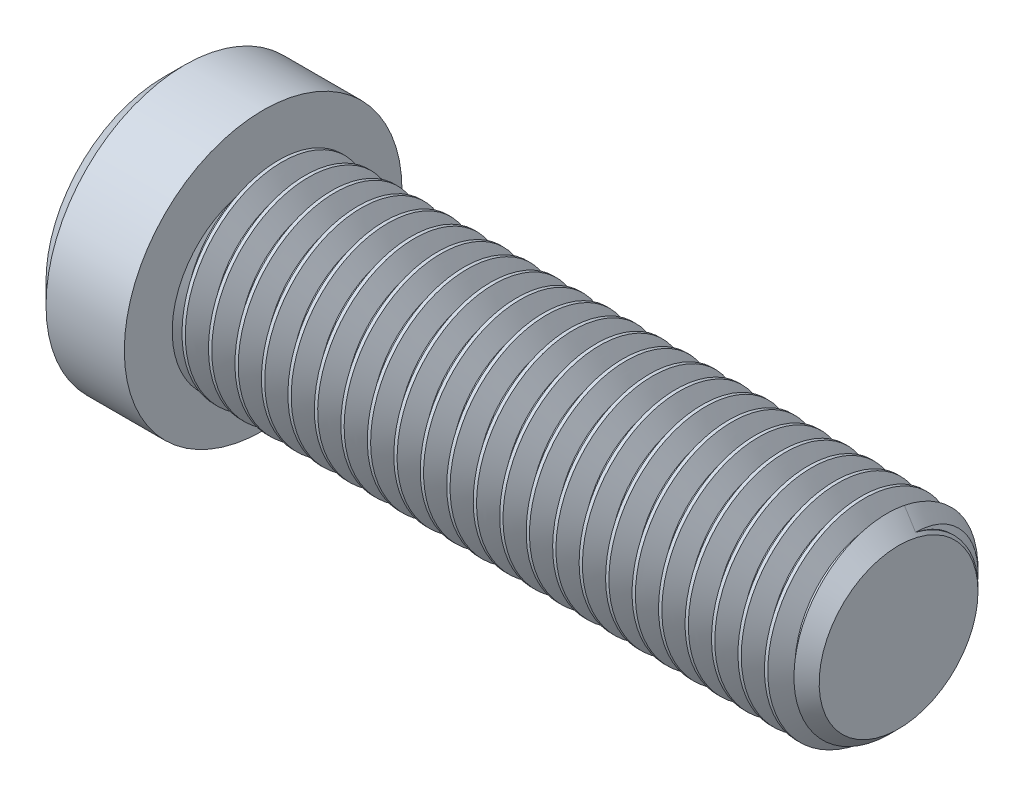
from build123d import *

# Parameters (mm, degrees)
SKETCH2_R           = 3.96875
BOSS_EXTRUDE1_DEPTH = 25.4
CHAMFER1_SIZE       = 0.79375
CUT_SWEEP1_PITCH    = 1.058333333
CUT_EXTRUDE1_DEPTH  = 2.794


with BuildPart() as part:
    # Sketch2 → Boss-Extrude1 (new body)
    with BuildSketch(Plane(origin=(12.7, 0, 0), x_dir=(0, 0, -1), z_dir=(1, 0, 0))):
        Circle(SKETCH2_R)
    extrude(amount=-BOSS_EXTRUDE1_DEPTH)

    # Chamfer1
    chamfer1_edges = [part.edges().sort_by_distance(p)[0] for p in [
        (12.7, 0, 3.96875),
    ]]
    chamfer(chamfer1_edges, length=CHAMFER1_SIZE)

    # Cut-Sweep1: the profile of Sketch5 profile screwed along a right-hand helix of 25 turns, 8 arcs to a turn; built about Z, then put on its axis
    cut_sweep1_z = Axis((0, 0, 0), (0, 0, 1))
    cut_sweep1_corners = [(3.96905, 0, 0.463194038), (3.96905, 0, -0.463194038), (3.281342336, 0, -0.066145833), (3.281342336, 0, 0.066145833)]
    with BuildLine(mode=Mode.PRIVATE) as cut_sweep1_profile:
        Line(cut_sweep1_corners[0], cut_sweep1_corners[1])
        Line(cut_sweep1_corners[1], cut_sweep1_corners[2])
        Line(cut_sweep1_corners[2], cut_sweep1_corners[3])
        Line(cut_sweep1_corners[3], cut_sweep1_corners[0])
    cut_sweep1_cap = Face(cut_sweep1_profile.wire())
    cut_sweep1_turn_angles = [0, 22.5, 45, 67.5, 90, 112.5, 135, 157.5, 180, 202.5, 225, 247.5, 270, 292.5, 315, 337.5, 360]
    cut_sweep1_turn_weights = [1, 0.9238795325112867, 1, 0.9238795325112867, 1, 0.9238795325112867, 1, 0.9238795325112867, 1, 0.9238795325112867, 1, 0.9238795325112867, 1, 0.9238795325112867, 1, 0.9238795325112867, 1]
    cut_sweep1_turn_rails = [Edge.make_bspline([Vector(p[0], p[1], 0).rotate(cut_sweep1_z, cut_sweep1_turn_angles[k]) / cut_sweep1_turn_weights[k] + Vector(0, 0, p[2] + CUT_SWEEP1_PITCH * cut_sweep1_turn_angles[k] / 360) for k in range(17)], [0, 0, 0, 1, 1, 2, 2, 3, 3, 4, 4, 5, 5, 6, 6, 7, 7, 8, 8, 8], 2, cut_sweep1_turn_weights) for p in cut_sweep1_corners]
    cut_sweep1_turn_sides = [Face.make_surface_from_curves(cut_sweep1_turn_rails[p[0]], cut_sweep1_turn_rails[p[1]]) for p in [(0, 1), (1, 2), (2, 3), (3, 0)]]
    cut_sweep1 = Plane(origin=(12.7, 0, 0), x_dir=(0, 1, 0), z_dir=(-1, 0, 0)) * Solid(Shell([*[p.moved(Location((0, 0, CUT_SWEEP1_PITCH * i))) for i in range(25) for p in cut_sweep1_turn_sides], cut_sweep1_cap, cut_sweep1_cap.rotate(cut_sweep1_z, 9000).moved(Location((0, 0, CUT_SWEEP1_PITCH * 9000 / 360)))]))
    add(cut_sweep1, mode=Mode.SUBTRACT)

    # Sketch6 → Revolve1 (revolve)
    with BuildSketch(Plane.XY, mode=Mode.PRIVATE) as revolve1_sk:
        Polygon((-15.83055, 5.5499), (-16.66875, 4.7117), (-16.66875, 0), (-12.7, 0), (-12.7, 5.5499), align=None)
    revolve(revolve1_sk.sketch.rotate(Axis((-12.7, 0, 0), (-1, 0, 0)), 13.865622854), axis=Axis((-12.7, 0, 0), (-1, 0, 0)))

    # Sketch4 → Cut-Extrude1 (cut)
    with BuildSketch(Plane(origin=(-16.66875, 0, 0), x_dir=(0, 0, -1), z_dir=(1, 0, 0))):
        Polygon((0, 2.291358881), (-1.984375, 1.14567944), (-1.984375, -1.14567944), (0, -2.291358881), (1.984375, -1.14567944), (1.984375, 1.14567944), align=None)
    extrude(amount=CUT_EXTRUDE1_DEPTH, mode=Mode.SUBTRACT)

    # Cut-Extrude2 cone 1 section (through the dimple's axis) → Cut-Extrude2 (revolve, cut)
    with BuildSketch(Plane(origin=(-16.66875, 0, 0), x_dir=(0, 0, 1), z_dir=(0, 1, 0))):
        Polygon((0, 0), (2.291358881, 0), (0, 2.291358881), align=None)
    revolve(axis=Axis((-16.66875, 0, 0), (1, 0, 0)), mode=Mode.SUBTRACT)


solid = part.part
